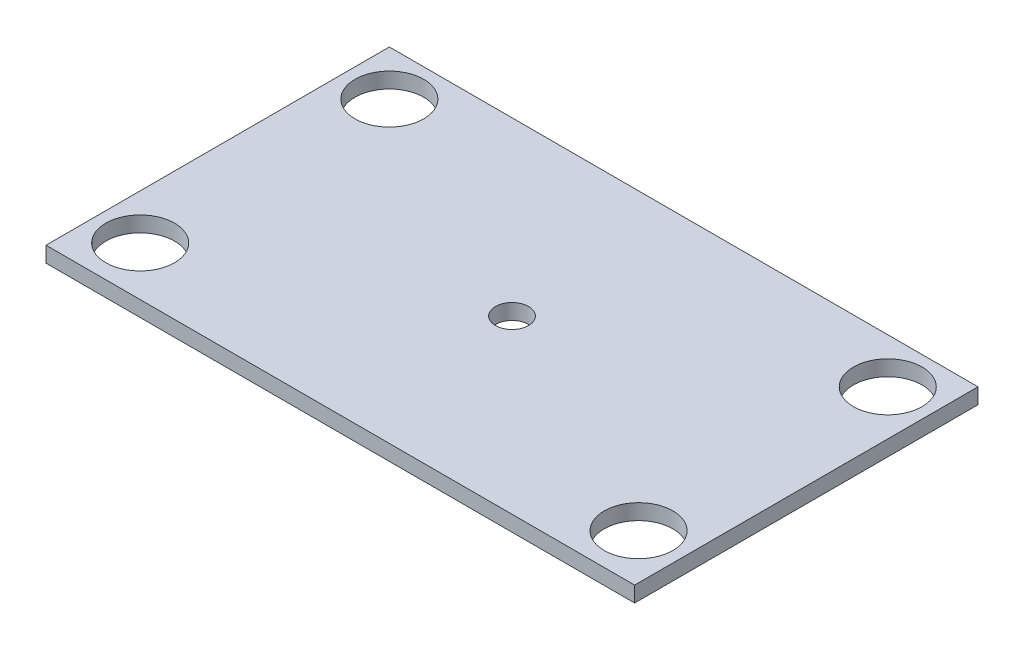
from build123d import *

# Parameters (mm, degrees)
SKETCH1_W           = 60
SKETCH1_H           = 35
SKETCH1_R           = 3.5
SKETCH1_R_2         = 1.6875
BOSS_EXTRUDE1_DEPTH = 1.5875


with BuildPart() as part:
    # Sketch1 → Boss-Extrude1 (new body)
    with BuildSketch(Plane(origin=(0, 0, 0), x_dir=(1, 0, 0), z_dir=(0, 1, 0))):
        with Locations((30, 17.5)):
            Rectangle(SKETCH1_W, SKETCH1_H)
        with Locations((4.6, 30.4)):
            Circle(SKETCH1_R, mode=Mode.SUBTRACT)
        with Locations((55.4, 30.4)):
            Circle(SKETCH1_R, mode=Mode.SUBTRACT)
        with Locations((4.6, 5)):
            Circle(SKETCH1_R, mode=Mode.SUBTRACT)
        with Locations((55.4, 5)):
            Circle(SKETCH1_R, mode=Mode.SUBTRACT)
        with Locations((30, 17.5)):
            Circle(SKETCH1_R_2, mode=Mode.SUBTRACT)
    extrude(amount=BOSS_EXTRUDE1_DEPTH)


solid = part.part
